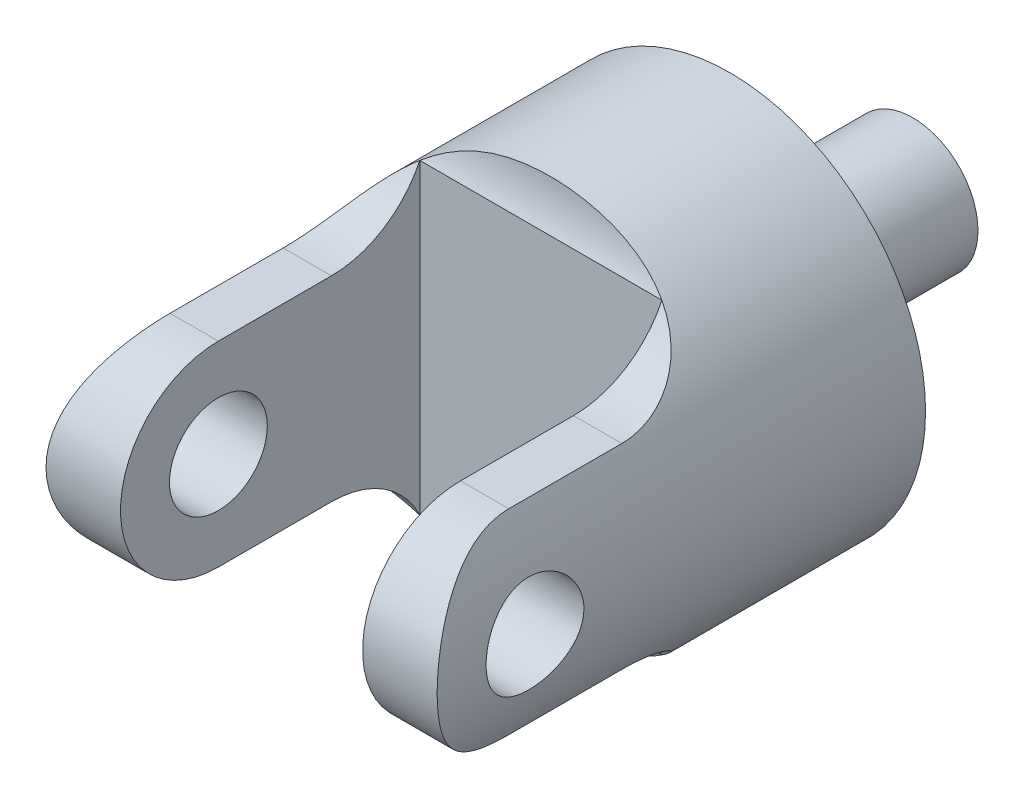
from build123d import *

# Parameters (mm, degrees)
SKETCH1_R                = 19.05
SKETCH1_R_2              = 6.35
BOSS_EXTRUDE1_DEPTH      = 47.57
BOSS_EXTRUDE2_DEPTH      = 18.42
BOSS_EXTRUDE2_DEPTH_BACK = 17.81
SKETCH1_3_R              = 6.35
CUT_EXTRUDE1_DEPTH       = 55.66909456
CUT_EXTRUDE1_DEPTH_BACK  = 55.66909456
SKETCH2_W                = 23.58
SKETCH2_H                = 29.15
CUT_EXTRUDE2_DEPTH       = 55.66909456
CUT_EXTRUDE2_DEPTH_BACK  = 55.66909456
CUT_EXTRUDE3_DEPTH       = 11.43
CUT_EXTRUDE4_DEPTH       = 55.669094717
CUT_EXTRUDE4_DEPTH_BACK  = 55.669094717
SKETCH3_3_R              = 4.765


with BuildPart() as part:
    # Sketch1 → Boss-Extrude1 (new body)
    with BuildSketch(Plane.XY):
        Circle(SKETCH1_R)
        Circle(SKETCH1_R_2, mode=Mode.SUBTRACT)
    extrude(amount=BOSS_EXTRUDE1_DEPTH)

    # Sketch1<3> → Boss-Extrude2 (add, two sides: drawn at the far end of the back side and taken through both)
    with BuildSketch(Plane.XY.offset(-BOSS_EXTRUDE2_DEPTH_BACK)):
        Circle(SKETCH1_3_R)
    extrude(amount=BOSS_EXTRUDE2_DEPTH + BOSS_EXTRUDE2_DEPTH_BACK)

    # Sketch2 → Cut-Extrude1 (cut, two sides: drawn at the far end of the back side and taken through both)
    with BuildSketch(Plane(origin=(0, 0, 0), x_dir=(1, 0, 0), z_dir=(0, 1, 0)).offset(-CUT_EXTRUDE1_DEPTH_BACK)):
        with Locations((0, -32.995)):
            Rectangle(SKETCH2_W, SKETCH2_H)
    extrude(amount=CUT_EXTRUDE1_DEPTH + CUT_EXTRUDE1_DEPTH_BACK, mode=Mode.SUBTRACT)

    # Sketch3 → Cut-Extrude2 (cut, two sides: drawn at the far end of the back side and taken through both)
    with BuildSketch(Plane(origin=(0, 0, 0), x_dir=(0, 0, -1), z_dir=(1, 0, 0)).offset(-CUT_EXTRUDE2_DEPTH_BACK)):
        with BuildLine():
            Line((-47.57, 9.53), (-47.57, 0))
            ThreePointArc((-47.57, 0), (-44.778727625, 6.738727625), (-38.04, 9.53))
            Line((-38.04, 9.53), (-27.024499758, 9.53))
            ThreePointArc((-27.024499758, 9.53), (-20.168211142, 25.679078971), (-36.548595412, 19.395413132))
            Line((-36.548595412, 19.395413132), (-59.695057595, 20.210569518))
            Line((-59.695057595, 20.210569518), (-67.817035002, 9.53))
            Line((-67.817035002, 9.53), (-47.57, 9.53))
        make_face()
        with BuildLine():
            ThreePointArc((-38.04, -9.53), (-44.778727625, -6.738727625), (-47.57, 0))
            Line((-47.57, 0), (-47.57, -9.53))
            Line((-47.57, -9.53), (-50.299929192, -9.53))
            Line((-50.299929192, -9.53), (-68.094621835, -9.164967532))
            Line((-68.094621835, -9.164967532), (-59.695057595, -20.210569518))
            Line((-59.695057595, -20.210569518), (-36.548595412, -19.395413132))
            ThreePointArc((-36.548595412, -19.395413132), (-20.168211151, -25.67907898), (-27.024499732, -9.53))
            Line((-27.024499732, -9.53), (-38.04, -9.53))
        make_face()
    extrude(amount=CUT_EXTRUDE2_DEPTH + CUT_EXTRUDE2_DEPTH_BACK, mode=Mode.SUBTRACT)

    # Sketch4 → Cut-Extrude3 (cut)
    with BuildSketch(Plane(origin=(0, 0, -17.81), x_dir=(-1, 0, 0), z_dir=(0, 0, -1))):
        Polygon((-4.20296324, -4.76), (4.20296324, -4.76), (5.639733731, -10.644362312), (-3.709014075, -10.08546978), align=None)
    extrude(amount=-CUT_EXTRUDE3_DEPTH, mode=Mode.SUBTRACT)

    # Sketch3<3> → Cut-Extrude4 (cut, two sides: drawn at the far end of the back side and taken through both)
    with BuildSketch(Plane(origin=(0, 0, 0), x_dir=(0, 0, -1), z_dir=(1, 0, 0)).offset(-CUT_EXTRUDE4_DEPTH_BACK)):
        with Locations((-38.04, 0)):
            Circle(SKETCH3_3_R)
    extrude(amount=CUT_EXTRUDE4_DEPTH + CUT_EXTRUDE4_DEPTH_BACK, mode=Mode.SUBTRACT)


solid = part.part
